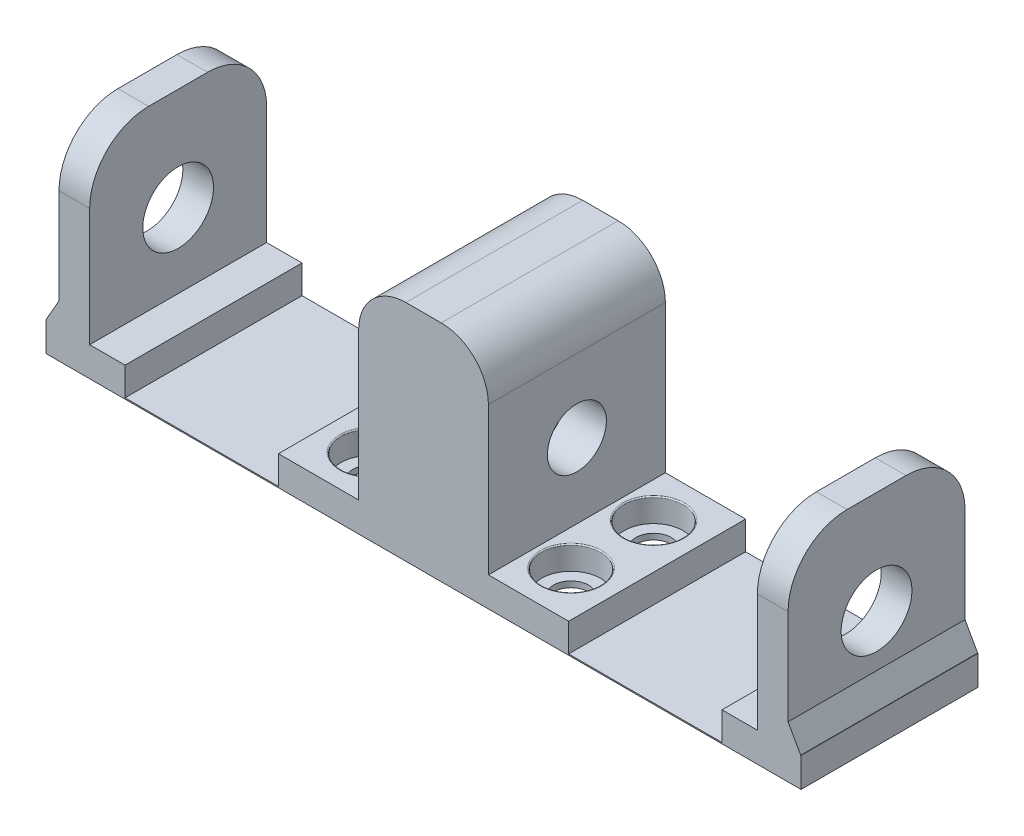
from build123d import *

# Parameters (mm, degrees)
SALIENTE_EXTRUIR1_DEPTH = 15
CROQUIS2_R              = 2.5
CORTAR_EXTRUIR1_DEPTH   = 3.5
CORTAR_EXTRUIR2_START   = -3.5
CROQUIS3_R              = 2.5
CORTAR_EXTRUIR2_DEPTH   = 3.5
CROQUIS4_R              = 2.5
CORTAR_EXTRUIR3_DEPTH   = 2
REDONDEO1_R             = 0.1
CROQUIS5_R              = 1.5
CORTAR_EXTRUIR4_DEPTH   = 26.089838581
CROQUIS6_W              = 15
CROQUIS6_H              = 2.5
SALIENTE_EXTRUIR2_DEPTH = 20.5
CROQUIS7_W              = 15
CROQUIS7_H              = 2.5
SALIENTE_EXTRUIR3_DEPTH = 20.5
CROQUIS8_W              = 2.6
CROQUIS8_H              = 15
SALIENTE_EXTRUIR4_DEPTH = 15
REDONDEO4_R             = 5
REDONDEO5_R             = 5
NERVIO1_REACH           = 36.213
CROQUIS17_WALL_W        = 72.622719
CROQUIS17_WALL_H        = 15
NERVIO2_REACH           = 36.213
CROQUIS22_WALL_W        = 72.632986608
CROQUIS22_WALL_H        = 15
CROQUIS23_R             = 3
CORTAR_EXTRUIR5_DEPTH   = 7
CORTAR_EXTRUIR6_START   = -7
CROQUIS24_R             = 3
CORTAR_EXTRUIR6_DEPTH   = 7
CROQUIS34_W             = 13
CROQUIS34_H             = 2.4
CORTAR_EXTRUIR7_DEPTH   = 37.595764782
CROQUIS35_R             = 1.5
CORTAR_EXTRUIR8_DEPTH   = 2.2


with BuildPart() as part:
    # Croquis1 → Saliente-Extruir1 (new body)
    with BuildSketch(Plane.XY):
        with BuildLine():
            Line((-1.5, 9.5), (1.5, 9.5))
            ThreePointArc((1.5, 9.5), (4.328427125, 8.328427125), (5.5, 5.5))
            Line((5.5, 5.5), (5.5, -7))
            Line((5.5, -7), (11.5, -7))
            Line((11.5, -7), (11.5, -9.5))
            Line((11.5, -9.5), (5.5, -9.5))
            Line((5.5, -9.5), (-5.5, -9.5))
            Line((-5.5, -9.5), (-11.5, -9.5))
            Line((-11.5, -9.5), (-11.5, -7))
            Line((-11.5, -7), (-5.5, -7))
            Line((-5.5, -7), (-5.5, 5.5))
            ThreePointArc((-5.5, 5.5), (-4.328427125, 8.328427125), (-1.5, 9.5))
        make_face()
    extrude(amount=-SALIENTE_EXTRUIR1_DEPTH)

    # Croquis2 → Cortar-Extruir1 (cut)
    with BuildSketch(Plane(origin=(5.5, 0, 0), x_dir=(0, 0, -1), z_dir=(1, 0, 0))):
        with Locations((7.5, -0.68)):
            Circle(CROQUIS2_R)
    extrude(amount=-CORTAR_EXTRUIR1_DEPTH, mode=Mode.SUBTRACT)

    # Croquis3 → Cortar-Extruir2 (cut)
    with BuildSketch(Plane.ZY.offset(5.5).offset(CORTAR_EXTRUIR2_START)):
        with Locations((-7.5, -0.68)):
            Circle(CROQUIS3_R)
    extrude(amount=CORTAR_EXTRUIR2_DEPTH, mode=Mode.SUBTRACT)

    # Croquis4 → Cortar-Extruir3 (cut)
    with BuildSketch(Plane(origin=(0, -7, 0), x_dir=(1, 0, 0), z_dir=(0, 1, 0))):
        with Locations((-8.5, 11)):
            Circle(CROQUIS4_R)
        with Locations((-8.5, 4)):
            Circle(CROQUIS4_R)
        with Locations((8.5, 4)):
            Circle(CROQUIS4_R)
        with Locations((8.5, 11)):
            Circle(CROQUIS4_R)
    extrude(amount=-CORTAR_EXTRUIR3_DEPTH, mode=Mode.SUBTRACT)

    # Redondeo1
    redondeo1_edges = [part.edges().sort_by_distance(p)[0] for p in [
        (6, -7, -4),
        (6, -7, -11),
        (-11, -7, -4),
        (-11, -7, -11),
    ]]
    fillet(redondeo1_edges, radius=REDONDEO1_R)

    # Croquis5 → Cortar-Extruir4 (cut, through all)
    with BuildSketch(Plane(origin=(0, -7, 0), x_dir=(1, 0, 0), z_dir=(0, 1, 0))):
        with Locations((-8.5, 11)):
            Circle(CROQUIS5_R)
        with Locations((-8.5, 4)):
            Circle(CROQUIS5_R)
        with Locations((8.5, 4)):
            Circle(CROQUIS5_R)
        with Locations((8.5, 11)):
            Circle(CROQUIS5_R)
    extrude(amount=-CORTAR_EXTRUIR4_DEPTH, mode=Mode.SUBTRACT)

    # Croquis6 → Saliente-Extruir2 (add)
    with BuildSketch(Plane.ZY.offset(11.5)):
        with Locations((-7.5, -8.25)):
            Rectangle(CROQUIS6_W, CROQUIS6_H)
    extrude(amount=SALIENTE_EXTRUIR2_DEPTH)

    # Croquis7 → Saliente-Extruir3 (add)
    with BuildSketch(Plane(origin=(11.5, 0, 0), x_dir=(0, 0, -1), z_dir=(1, 0, 0))):
        with Locations((7.5, -8.25)):
            Rectangle(CROQUIS7_W, CROQUIS7_H)
    extrude(amount=SALIENTE_EXTRUIR3_DEPTH)

    # Croquis8 → Saliente-Extruir4 (add)
    with BuildSketch(Plane(origin=(0, -7, 0), x_dir=(1, 0, 0), z_dir=(0, 1, 0))):
        with Locations((-29.6, 7.5)):
            Rectangle(CROQUIS8_W, CROQUIS8_H)
        with Locations((29.6, 7.5)):
            Rectangle(CROQUIS8_W, CROQUIS8_H)
    extrude(amount=SALIENTE_EXTRUIR4_DEPTH)

    # Redondeo4
    redondeo4_edges = [part.edges().sort_by_distance(p)[0] for p in [
        (-29.6, 8, -15),
        (-29.6, 8, 0),
    ]]
    fillet(redondeo4_edges, radius=REDONDEO4_R)

    # Redondeo5
    redondeo5_edges = [part.edges().sort_by_distance(p)[0] for p in [
        (29.6, 8, -15),
        (29.6, 8, 0),
    ]]
    fillet(redondeo5_edges, radius=REDONDEO5_R)

    # Croquis17 wall → Nervio1 (add, up to next)
    with BuildSketch(Plane(origin=(31.436186969, -6.040917019, -7.5), x_dir=(0.487980049568, -0.872854782437, 0), z_dir=(0.872854782437, 0.487980049568, 0)), mode=Mode.PRIVATE) as nervio1_sk1:
        Rectangle(CROQUIS17_WALL_W, CROQUIS17_WALL_H)
    nervio1_tool1 = extrude(nervio1_sk1.sketch, amount=-NERVIO1_REACH, mode=Mode.PRIVATE) - part.part
    add(nervio1_tool1.solids().sort_by_distance((31.436186969, -6.040917019, -7.5))[0])

    # Croquis22 wall → Nervio2 (add, up to next)
    with BuildSketch(Plane(origin=(-31.446630364, -6.040917019, -7.5), x_dir=(0.495170953156, 0.868795561194, 0), z_dir=(-0.868795561194, 0.495170953156, 0)), mode=Mode.PRIVATE) as nervio2_sk1:
        Rectangle(CROQUIS22_WALL_W, CROQUIS22_WALL_H)
    nervio2_tool1 = extrude(nervio2_sk1.sketch, amount=-NERVIO2_REACH, mode=Mode.PRIVATE) - part.part
    add(nervio2_tool1.solids().sort_by_distance((-31.446630364, -6.040917019, -7.5))[0])

    # Croquis23 → Cortar-Extruir5 (cut)
    with BuildSketch(Plane(origin=(30.9, 0, 0), x_dir=(0, 0, -1), z_dir=(1, 0, 0))):
        with Locations((7.5, -0.68)):
            Circle(CROQUIS23_R)
    extrude(amount=-CORTAR_EXTRUIR5_DEPTH, mode=Mode.SUBTRACT)

    # Croquis24 → Cortar-Extruir6 (cut)
    with BuildSketch(Plane.ZY.offset(30.9).offset(CORTAR_EXTRUIR6_START)):
        with Locations((-7.5, -0.68)):
            Circle(CROQUIS24_R)
    extrude(amount=CORTAR_EXTRUIR6_DEPTH, mode=Mode.SUBTRACT)

    # Croquis34 → Cortar-Extruir7 (cut, through all)
    with BuildSketch(Plane.XY):
        with Locations((-18.8, -8.2)):
            Rectangle(CROQUIS34_W, CROQUIS34_H)
        with Locations((18.8, -8.2)):
            Rectangle(CROQUIS34_W, CROQUIS34_H)
    extrude(amount=-CORTAR_EXTRUIR7_DEPTH, mode=Mode.SUBTRACT)

    # Croquis35 → Cortar-Extruir8 (cut)
    with BuildSketch(Plane.XZ.offset(9.5)):
        with Locations((-30, -4)):
            Circle(CROQUIS35_R)
        with Locations((-30, -11)):
            Circle(CROQUIS35_R)
        with Locations((30, -11)):
            Circle(CROQUIS35_R)
        with Locations((30, -4)):
            Circle(CROQUIS35_R)
    extrude(amount=-CORTAR_EXTRUIR8_DEPTH, mode=Mode.SUBTRACT)


solid = part.part
